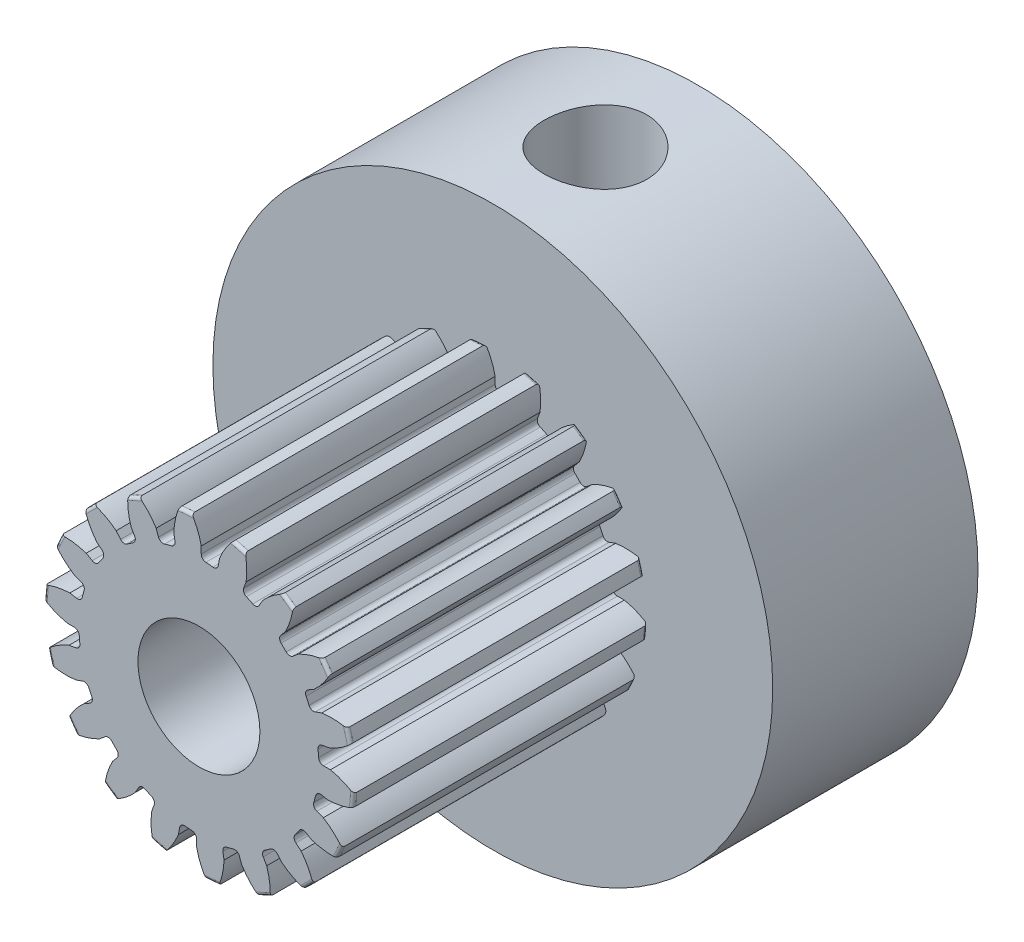
from build123d import *
from build123d.topology import SkipClean

# Parameters (mm, degrees)
SKETCH1_R                = 10.541
BOSS_EXTRUDE1_DEPTH      = 20
SKETCH2_W                = 13.97
SKETCH2_H                = 6.35
FILLET2_R                = 0.21082
CUT_EXTRUDE1_DEPTH       = 38.096984597
FILLET1_R                = 0.332486
CIRPATTERN1_COUNT        = 18
FILLET1_OF_CIRPATTERN1_R = 0.332486
SKETCH5_R                = 3.175
CUT_EXTRUDE2_DEPTH       = 38.090586389
CHAMFER1_SIZE            = 0.3175
SKETCH8_W                = 6.35
SKETCH8_H                = 1.7526
CUT_SWEEP1_PITCH         = 0.79375
SKETCH12_W               = 1.7526
SKETCH12_H               = 3.175
CHAMFER3_SIZE            = 0.280416
CUT_SWEEP2_PITCH         = 0.79375
CUT_EXTRUDE4_DEPTH       = 2.032
SKETCH19_R               = 19.05
SKETCH19_R_2             = 3.175
BOSS_EXTRUDE3_DEPTH      = 13.97
SKETCH20_W               = 12.7
SKETCH20_H               = 6.35
CUT_EXTRUDE8_DEPTH       = 12.7
SKETCH21_R               = 3.4925
CUT_EXTRUDE9_DEPTH       = 19.05
M8_CLEARANCE_HOLE1_D     = 8.3


with BuildPart() as part:
    # Sketch1 → Boss-Extrude1 (new body)
    with BuildSketch(Plane.XY):
        Circle(SKETCH1_R)
    extrude(amount=-BOSS_EXTRUDE1_DEPTH)

    # Sketch2 → Revolve1 (revolve)
    with BuildSketch(Plane(origin=(0, 0, 0), x_dir=(0, 0, -1), z_dir=(1, 0, 0)), mode=Mode.PRIVATE) as revolve1_sk:
        with Locations((26.985, 3.175)):
            Rectangle(SKETCH2_W, SKETCH2_H)
    revolve(revolve1_sk.sketch.rotate(Axis((0, 0, -20), (0, 0, -1)), 90), axis=Axis((0, 0, -20), (0, 0, -1)))

    # Fillet2
    fillet2_edges = [part.edges().sort_by_distance(p)[0] for p in [
        (-10.541, 0, 0),
        (-10.541, 0, -20),
        (-6.35, 0, -20),
    ]]
    fillet(fillet2_edges, radius=FILLET2_R)

    # Sketch4 → Cut-Extrude1 (cut, through all)
    with BuildSketch(Plane.XY):
        with BuildLine():
            Line((0.157561629, 8.949185285), (0.157561629, 8.158228631))
            ThreePointArc((0.157561629, 8.158228631), (0.711170731, 8.128699543), (1.261496911, 8.061646582))
            Line((1.261496911, 8.061646582), (1.398845411, 8.840586771))
            add(Edge.make_bspline(
                [(4.497758077, 11.696351513), (2.192075376, 10.823747212), (1.398845411, 8.840586771)],
                knots=[0, 0, 0, 1, 1, 1], degree=2))
            ThreePointArc((4.497758077, 11.696351513), (1.092180738, 12.483653619), (-2.39837188, 12.299686125))
            add(Edge.make_bspline(
                [(-2.39837188, 12.299686125), (-0.279244341, 11.039960179), (0.157561629, 8.949185285)],
                knots=[0, 0, 0, 1, 1, 1], degree=2))
        make_face()
    cut_extrude1 = extrude(amount=-CUT_EXTRUDE1_DEPTH, mode=Mode.SUBTRACT)

    # Fillet1
    fillet1_edges = [part.edges().sort_by_distance(p)[0] for p in [
        (1.261496911, 8.061646582, -10),
        (0.157561629, 8.158228631, -10),
    ]]
    fillet(fillet1_edges, radius=FILLET1_R)

    # CirPattern1: Cut-Extrude1 ×18 about axis
    cirpattern1_axis = Axis((0, 0, -20), (0, 0, 1))
    for i in range(1, CIRPATTERN1_COUNT):
        add(cut_extrude1.rotate(cirpattern1_axis, i * 360 / CIRPATTERN1_COUNT), mode=Mode.SUBTRACT)

    # Fillet1 of CirPattern1
    fillet1_of_cirpattern1_edges = [part.edges().sort_by_distance(p)[0] for p in [
        (-1.57182618, 8.006927158, -10),
        (-2.642219026, 7.720116494, -10),
        (-4.215563837, 6.98645415, -10),
        (-5.123309071, 6.350844371, -10),
        (-6.35084228, 5.123311663, -10),
        (-6.98645243, 4.215566689, -10),
        (-7.720115416, 2.642222177, -10),
        (-8.006926517, 1.571829448, -10),
        (-8.158228695, -0.157558299, -10),
        (-8.061647096, -1.261493621, -10),
        (-7.612339192, -2.938334919, -10),
        (-7.144014059, -3.942661942, -10),
        (-6.148289235, -5.364704982, -10),
        (-5.364707491, -6.148287046, -10),
        (-3.942664858, -7.14401245, -10),
        (-2.938338026, -7.612337992, -10),
        (-1.261496911, -8.061646582, -10),
        (-0.157561629, -8.158228631, -10),
        (1.57182618, -8.006927158, -10),
        (2.642219026, -7.720116494, -10),
        (4.215563837, -6.98645415, -10),
        (5.123309071, -6.350844371, -10),
        (6.35084228, -5.123311663, -10),
        (6.98645243, -4.215566689, -10),
        (7.720115416, -2.642222177, -10),
        (8.006926517, -1.571829448, -10),
        (8.158228695, 0.157558299, -10),
        (8.061647096, 1.261493621, -10),
        (7.612339192, 2.938334919, -10),
        (7.144014059, 3.942661942, -10),
        (6.148289235, 5.364704982, -10),
        (5.364707491, 6.148287046, -10),
        (3.942664858, 7.14401245, -10),
        (2.938338026, 7.612337992, -10),
    ]]
    fillet(fillet1_of_cirpattern1_edges, radius=FILLET1_OF_CIRPATTERN1_R)

    # Sketch5 → Cut-Extrude2 (cut, through all)
    with BuildSketch(Plane.XY):
        Circle(SKETCH5_R)
    extrude(amount=-CUT_EXTRUDE2_DEPTH, mode=Mode.SUBTRACT)

    # Chamfer1
    chamfer1_edges = [part.edges().sort_by_distance(p)[0] for p in [
        (-6.35, 0, -33.97),
        (-3.175, 0, -33.97),
        (-3.175, 0, 0),
    ]]
    chamfer(chamfer1_edges, length=CHAMFER1_SIZE)


with BuildPart() as body_2:
    # Sketch8 → Revolve2 (revolve)
    with BuildSketch(Plane(origin=(0, 0, 0), x_dir=(0, -1, 0), z_dir=(1, 0, 0)), mode=Mode.PRIVATE) as revolve2_sk:
        with Locations((-3.175, 27.80796)):
            Rectangle(SKETCH8_W, SKETCH8_H)
    revolve(revolve2_sk.sketch.rotate(Axis((0, 6.35, -26.93166), (0, -1, 0)), 180), axis=Axis((0, 6.35, -26.93166), (0, -1, 0)))

    # Cut-Sweep1: the profile of Sketch11 profile screwed along a right-hand helix of 8 turns, 8 arcs to a turn; built about Z, then put on its axis
    with SkipClean():  # the faces are left unmerged after this step: merging them gives an invalid solid
        cut_sweep1_z = Axis((0, 0, 0), (0, 0, 1))
        cut_sweep1_corners = [(1.7529, 0, 0.000173205), (1.7529, 0, -0.694704455), (1.237044252, 0, -0.396875), (1.237044252, 0, -0.29765625)]
        with BuildLine(mode=Mode.PRIVATE) as cut_sweep1_profile:
            Line(cut_sweep1_corners[0], cut_sweep1_corners[1])
            Line(cut_sweep1_corners[1], cut_sweep1_corners[2])
            Line(cut_sweep1_corners[2], cut_sweep1_corners[3])
            Line(cut_sweep1_corners[3], cut_sweep1_corners[0])
        cut_sweep1_cap = Face(cut_sweep1_profile.wire())
        cut_sweep1_turn_angles = [0, 22.5, 45, 67.5, 90, 112.5, 135, 157.5, 180, 202.5, 225, 247.5, 270, 292.5, 315, 337.5, 360]
        cut_sweep1_turn_weights = [1, 0.9238795325112867, 1, 0.9238795325112867, 1, 0.9238795325112867, 1, 0.9238795325112867, 1, 0.9238795325112867, 1, 0.9238795325112867, 1, 0.9238795325112867, 1, 0.9238795325112867, 1]
        cut_sweep1_turn_rails = [Edge.make_bspline([Vector(p[0], p[1], 0).rotate(cut_sweep1_z, cut_sweep1_turn_angles[k]) / cut_sweep1_turn_weights[k] + Vector(0, 0, p[2] + CUT_SWEEP1_PITCH * cut_sweep1_turn_angles[k] / 360) for k in range(17)], [0, 0, 0, 1, 1, 2, 2, 3, 3, 4, 4, 5, 5, 6, 6, 7, 7, 8, 8, 8], 2, cut_sweep1_turn_weights) for p in cut_sweep1_corners]
        cut_sweep1_turn_sides = [Face.make_surface_from_curves(cut_sweep1_turn_rails[p[0]], cut_sweep1_turn_rails[p[1]]) for p in [(0, 1), (1, 2), (2, 3), (3, 0)]]
        cut_sweep1 = Plane(origin=(0, 6.35, -26.93166), x_dir=(0, 0, -1), z_dir=(0, -1, 0)) * Solid(Shell([*[p.moved(Location((0, 0, CUT_SWEEP1_PITCH * i))) for i in range(8) for p in cut_sweep1_turn_sides], cut_sweep1_cap, cut_sweep1_cap.rotate(cut_sweep1_z, 2880).moved(Location((0, 0, CUT_SWEEP1_PITCH * 2880 / 360)))]))
        add(cut_sweep1, mode=Mode.SUBTRACT)

    # Boss-Extrude2 cone 1 section (through the dimple's axis) → Boss-Extrude2 (revolve)
    with SkipClean():  # the faces are left unmerged after this step: merging them gives an invalid solid
        with BuildSketch(Plane(origin=(0, 6.35, -26.93166), x_dir=(0, 0, 1), z_dir=(1, 0, 0))):
            Polygon((0, 0), (1.892808, 0), (0, 1.892808), align=None)
        revolve(axis=Axis((0, 6.35, -26.93166), (0, -1, 0)))


with BuildPart() as part_1:
    add(part.part)

    # Combine1: union body 2
    add(body_2.part)



with BuildPart() as body_2_2:
    # Sketch12 → Revolve3 (revolve)
    with BuildSketch(Plane(origin=(0, 0, 0), x_dir=(0, 0, -1), z_dir=(1, 0, 0))):
        with Locations((27.80796, 4.7625)):
            Rectangle(SKETCH12_W, SKETCH12_H)
    revolve(axis=Axis((0, 3.175, -26.93166), (0, 1, 0)))

    # Chamfer3
    chamfer3_edges = [body_2_2.edges().sort_by_distance(p)[0] for p in [
        (0, 3.175, -25.17906),
        (0, 6.35, -25.17906),
    ]]
    chamfer(chamfer3_edges, length=CHAMFER3_SIZE)

    # Cut-Sweep2: the profile of Sketch15 profile screwed along a right-hand helix of 5 turns, 8 arcs to a turn; built about Z, then put on its axis
    cut_sweep2_z = Axis((0, 0, 0), (0, 0, 1))
    cut_sweep2_corners = [(1.7529, 0, 0.000173205), (1.7529, 0, -0.694704455), (1.237044252, 0, -0.396875), (1.237044252, 0, -0.29765625)]
    with BuildLine(mode=Mode.PRIVATE) as cut_sweep2_profile:
        Line(cut_sweep2_corners[0], cut_sweep2_corners[1])
        Line(cut_sweep2_corners[1], cut_sweep2_corners[2])
        Line(cut_sweep2_corners[2], cut_sweep2_corners[3])
        Line(cut_sweep2_corners[3], cut_sweep2_corners[0])
    cut_sweep2_cap = Face(cut_sweep2_profile.wire())
    cut_sweep2_turn_angles = [0, 22.5, 45, 67.5, 90, 112.5, 135, 157.5, 180, 202.5, 225, 247.5, 270, 292.5, 315, 337.5, 360]
    cut_sweep2_turn_weights = [1, 0.9238795325112867, 1, 0.9238795325112867, 1, 0.9238795325112867, 1, 0.9238795325112867, 1, 0.9238795325112867, 1, 0.9238795325112867, 1, 0.9238795325112867, 1, 0.9238795325112867, 1]
    cut_sweep2_turn_rails = [Edge.make_bspline([Vector(p[0], p[1], 0).rotate(cut_sweep2_z, cut_sweep2_turn_angles[k]) / cut_sweep2_turn_weights[k] + Vector(0, 0, p[2] + CUT_SWEEP2_PITCH * cut_sweep2_turn_angles[k] / 360) for k in range(17)], [0, 0, 0, 1, 1, 2, 2, 3, 3, 4, 4, 5, 5, 6, 6, 7, 7, 8, 8, 8], 2, cut_sweep2_turn_weights) for p in cut_sweep2_corners]
    cut_sweep2_turn_sides = [Face.make_surface_from_curves(cut_sweep2_turn_rails[p[0]], cut_sweep2_turn_rails[p[1]]) for p in [(0, 1), (1, 2), (2, 3), (3, 0)]]
    cut_sweep2 = Plane(origin=(0, 6.35, -26.93166), x_dir=(0, 0, -1), z_dir=(0, -1, 0)) * Solid(Shell([*[p.moved(Location((0, 0, CUT_SWEEP2_PITCH * i))) for i in range(5) for p in cut_sweep2_turn_sides], cut_sweep2_cap, cut_sweep2_cap.rotate(cut_sweep2_z, 1800).moved(Location((0, 0, CUT_SWEEP2_PITCH * 1800 / 360)))]))
    add(cut_sweep2, mode=Mode.SUBTRACT)

    # Sketch16 → Cut-Extrude4 (cut)
    with BuildSketch(Plane(origin=(0, 6.35, 0), x_dir=(1, 0, 0), z_dir=(0, 1, 0))):
        Polygon((0, 27.848203552), (-0.79375, 27.389931776), (-0.79375, 26.473388224), (0, 26.015116448), (0.79375, 26.473388224), (0.79375, 27.389931776), align=None)
    extrude(amount=-CUT_EXTRUDE4_DEPTH, mode=Mode.SUBTRACT)

    # Cut-Extrude5 cone 1 section (through the dimple's axis) → Cut-Extrude5 (revolve, cut)
    with BuildSketch(Plane(origin=(0, 6.35, -26.93166), x_dir=(0, 0, 1), z_dir=(1, 0, 0))):
        Polygon((0, 0), (0.916543552, 0), (0, 0.916543552), align=None)
    revolve(axis=Axis((0, 6.35, -26.93166), (0, -1, 0)), mode=Mode.SUBTRACT)

    # Cut-Extrude6 cone 1 section (through the dimple's axis) → Cut-Extrude6 (revolve, cut)
    with BuildSketch(Plane(origin=(0, 4.318, -26.93166), x_dir=(0, 0, 1), z_dir=(1, 0, 0))):
        Polygon((0, 0), (0.79375, 0), (0, 0.458271776), align=None)
    revolve(axis=Axis((0, 4.318, -26.93166), (0, -1, 0)), mode=Mode.SUBTRACT)


with BuildPart() as part_2:
    add(part_1.part)

    add(body_2_2.part)  # Boss-Extrude3 merges body 2 2
    # Sketch19 → Boss-Extrude3 (add)
    with BuildSketch(Plane(origin=(0, 0, -20), x_dir=(-1, 0, 0), z_dir=(0, 0, -1))):
        with Locations(Location((0, 0, 0), (0, 0, 180))):
            Circle(SKETCH19_R)
        Circle(SKETCH19_R_2, mode=Mode.SUBTRACT)
    extrude(amount=BOSS_EXTRUDE3_DEPTH)

    # Sketch20 → Cut-Extrude8 (cut)
    with BuildSketch(Plane(origin=(0, 0, -33.97), x_dir=(-1, 0, 0), z_dir=(0, 0, -1))):
        with Locations((0, 10.16)):
            Rectangle(SKETCH20_W, SKETCH20_H)
    extrude(amount=-CUT_EXTRUDE8_DEPTH, mode=Mode.SUBTRACT)

    # Sketch21 → Cut-Extrude9 (cut)
    with BuildSketch(Plane(origin=(0, 19.05, 0), x_dir=(1, 0, 0), z_dir=(0, 1, 0))):
        with Locations(Location((0, 26.985, 0), (0, 0, 270))):
            Circle(SKETCH21_R)
    extrude(amount=-CUT_EXTRUDE9_DEPTH, mode=Mode.SUBTRACT)

    # M8 Clearance Hole1 (through all)
    with Locations(Plane.XY):
        with Locations((0, 0)):
            Hole(M8_CLEARANCE_HOLE1_D / 2)


solid = part_2.part
